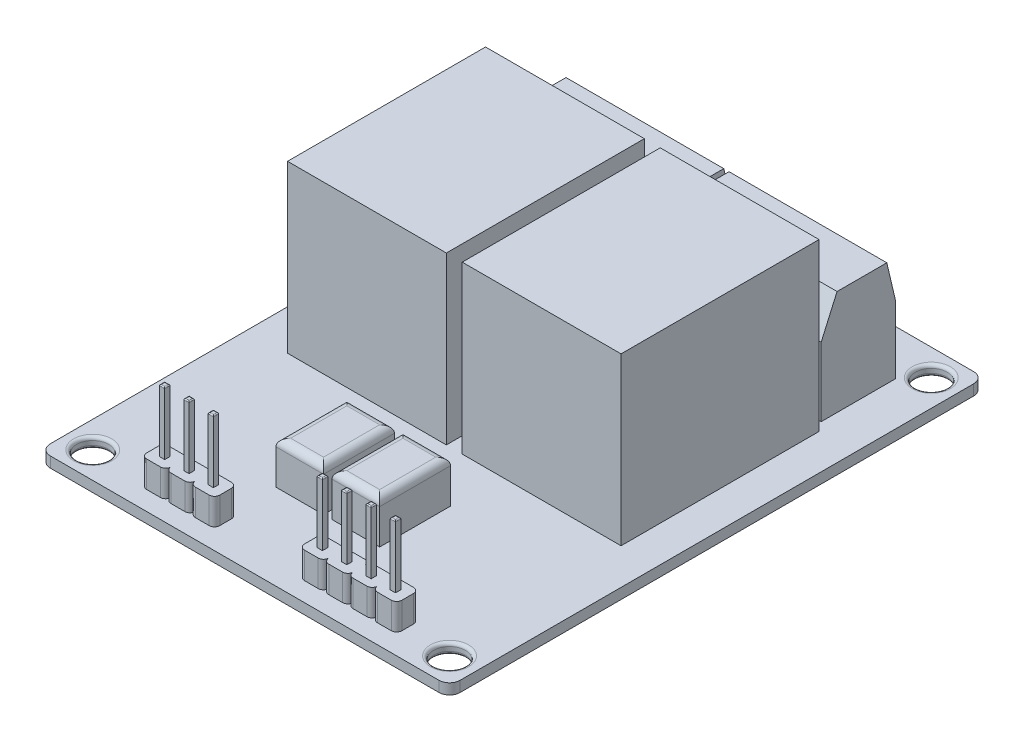
from build123d import *

# Parameters (mm, degrees)
CROQUIS1_W               = 38.7
CROQUIS1_H               = 50.5
SALIENTE_EXTRUIR1_DEPTH  = 1
CROQUIS2_W               = 15
CROQUIS2_H               = 18.7
SALIENTE_EXTRUIR2_DEPTH  = 15.7
CROQUIS3_W               = 14.9
CROQUIS3_H               = 7
SALIENTE_EXTRUIR3_DEPTH  = 9.9
CORTAR_EXTRUIR1_DEPTH    = 64.197310069
CROQUIS5_W               = 4.5
CROQUIS5_H               = 6.7
SALIENTE_EXTRUIR4_DEPTH  = 4
REDONDEO1_R              = 0.7
CROQUIS6_W               = 2.3
CROQUIS6_H               = 2.1
SALIENTE_EXTRUIR5_DEPTH  = 2.5
REDONDEO2_R              = 0.5
CROQUIS6_3_W             = 2.3
CROQUIS6_3_H             = 2.1
SALIENTE_EXTRUIR6_DEPTH  = 2.5
REDONDEO4_R              = 0.5
CROQUIS6_4_W             = 2.3
CROQUIS6_4_H             = 2.1
SALIENTE_EXTRUIR7_DEPTH  = 2.5
REDONDEO5_R              = 0.5
CROQUIS6_5_W             = 2.3
CROQUIS6_5_H             = 2.1
SALIENTE_EXTRUIR8_DEPTH  = 2.5
REDONDEO6_R              = 0.5
CROQUIS6_6_W             = 2.3
CROQUIS6_6_H             = 2.1
SALIENTE_EXTRUIR9_DEPTH  = 2.5
REDONDEO7_R              = 0.5
CROQUIS6_7_W             = 2.3
CROQUIS6_7_H             = 2.1
SALIENTE_EXTRUIR10_DEPTH = 2.5
REDONDEO8_R              = 0.5
CROQUIS8_W               = 0.5
CROQUIS8_H               = 0.5
SALIENTE_EXTRUIR11_DEPTH = 5.9
REDONDEO13_R             = 0.1
REDONDEO14_R             = 1
REDONDEO15_R             = 1
CROQUIS9_R               = 1.5
CORTAR_EXTRUIR2_DEPTH    = 5.9
REDONDEO16_R             = 0.3


# Some blends are built 0.0001 mm under size
with BuildPart() as part:
    # Croquis1 → Saliente-Extruir1 (new body)
    with BuildSketch(Plane(origin=(0, 0, 0), x_dir=(1, 0, 0), z_dir=(0, 1, 0))):
        with Locations((19.35, -25.25)):
            Rectangle(CROQUIS1_W, CROQUIS1_H)
    extrude(amount=-SALIENTE_EXTRUIR1_DEPTH)

    # Croquis2 → Saliente-Extruir2 (add)
    with BuildSketch(Plane(origin=(0, 0, 0), x_dir=(1, 0, 0), z_dir=(0, 1, 0))):
        with Locations((11.3, -21.55)):
            Rectangle(CROQUIS2_W, CROQUIS2_H)
        with Locations((27.8, -21.55)):
            Rectangle(CROQUIS2_W, CROQUIS2_H)
    extrude(amount=SALIENTE_EXTRUIR2_DEPTH)

    # Croquis3 → Saliente-Extruir3 (add)
    with BuildSketch(Plane(origin=(0, 0, 0), x_dir=(1, 0, 0), z_dir=(0, 1, 0))):
        with Locations((11.75, -7.8)):
            Rectangle(CROQUIS3_W, CROQUIS3_H)
        with Locations((27.15, -7.8)):
            Rectangle(CROQUIS3_W, CROQUIS3_H)
    extrude(amount=SALIENTE_EXTRUIR3_DEPTH)

    # Croquis4 → Cortar-Extruir1 (cut, through all)
    with BuildSketch(Plane(origin=(34.6, 0, 0), x_dir=(0, 0, -1), z_dir=(1, 0, 0))):
        Polygon((-11.3, 9.9), (-11.3, 6.5), (-9.8, 9.9), align=None)
        Polygon((-5.1, 9.9), (-4.3, 6.5), (-4.3, 9.9), align=None)
    extrude(amount=-CORTAR_EXTRUIR1_DEPTH, mode=Mode.SUBTRACT)

    # Croquis5 → Saliente-Extruir4 (add)
    with BuildSketch(Plane(origin=(0, 0, 0), x_dir=(1, 0, 0), z_dir=(0, 1, 0))):
        with Locations((16.45, -39.05)):
            Rectangle(CROQUIS5_W, CROQUIS5_H)
        with Locations((21.75, -39.05)):
            Rectangle(CROQUIS5_W, CROQUIS5_H)
    extrude(amount=SALIENTE_EXTRUIR4_DEPTH)

    # Redondeo1
    redondeo1_edges = [part.edges().sort_by_distance(p)[0] for p in [
        (14.2, 4, 39.05),
        (16.45, 4, 42.4),
        (18.7, 4, 39.05),
        (16.45, 4, 35.7),
        (19.5, 4, 39.05),
        (21.75, 4, 42.4),
        (24, 4, 39.05),
        (21.75, 4, 35.7),
    ]]
    fillet(redondeo1_edges, radius=REDONDEO1_R)

    # Croquis6 → Saliente-Extruir5 (add)
    with BuildSketch(Plane(origin=(0, 0, 0), x_dir=(1, 0, 0), z_dir=(0, 1, 0))):
        with Locations((30.75, -47.65)):
            Rectangle(CROQUIS6_W, CROQUIS6_H)
    extrude(amount=SALIENTE_EXTRUIR5_DEPTH)

    # Redondeo2
    redondeo2_edges = [part.edges().sort_by_distance(p)[0] for p in [
        (31.9, 1.25, 46.6),
        (29.6, 1.25, 46.6),
        (29.6, 1.25, 48.7),
        (31.9, 1.25, 48.7),
    ]]
    fillet(redondeo2_edges, radius=REDONDEO2_R)

    # Croquis6<3> → Saliente-Extruir6 (add)
    with BuildSketch(Plane(origin=(0, 0, 0), x_dir=(1, 0, 0), z_dir=(0, 1, 0))):
        with Locations((28.45, -47.65)):
            Rectangle(CROQUIS6_3_W, CROQUIS6_3_H)
    extrude(amount=SALIENTE_EXTRUIR6_DEPTH)

    # Redondeo4
    redondeo4_edges = [part.edges().sort_by_distance(p)[0] for p in [
        (27.3, 1.25, 48.7),
        (29.6, 1.25, 46.6),
        (27.3, 1.25, 46.6),
        (29.6, 1.25, 48.7),
    ]]
    fillet(redondeo4_edges, radius=REDONDEO4_R - 0.0001)  # a hair under: the kernel refuses the full size

    # Croquis6<4> → Saliente-Extruir7 (add)
    with BuildSketch(Plane(origin=(0, 0, 0), x_dir=(1, 0, 0), z_dir=(0, 1, 0))):
        with Locations((26.15, -47.65)):
            Rectangle(CROQUIS6_4_W, CROQUIS6_4_H)
    extrude(amount=SALIENTE_EXTRUIR7_DEPTH)

    # Redondeo5
    # the kernel refuses this fillet: 0.5 mm, written as the material it takes off along each edge
    with BuildSketch(Plane(origin=(27.3, 0, 46.6), x_dir=(-1, 0, 0), z_dir=(0, 1, 0))) as redondeo5_piece_1_section:
        with BuildLine():
            CenterArc((0.49999999, 0.5), REDONDEO5_R, 180.011459156, 89.988540844)
            Line((0, 0.4999), (-0.01, 0.499898))
            Line((-0.01, 0.499898), (-0.01, 0))
            Line((-0.01, 0), (0, -0.01))
            Line((0, -0.01), (0.49999999, -0.01))
            Line((0.49999999, -0.01), (0.49999999, 0))
        make_face()
    redondeo5_piece_1 = extrude(amount=3.749999975, mode=Mode.PRIVATE)
    redondeo5_piece_1 = redondeo5_piece_1 - Plane(origin=(27.7999, 1.874999988, 47.0999), x_dir=(-1, 0, 0), z_dir=(0, 1, 0)) * Cylinder(0.4999, 10, mode=Mode.PRIVATE)
    add(redondeo5_piece_1, mode=Mode.SUBTRACT)
    with BuildSketch(Plane(origin=(25, 0, 46.6), x_dir=(0, 0, 1), z_dir=(0, 1, 0)), Plane(origin=(25, 0, 48.7), x_dir=(1, 0, 0), z_dir=(0, 1, 0))) as redondeo5_piece_2:
        with BuildLine():
            CenterArc((REDONDEO5_R, REDONDEO5_R), REDONDEO5_R, 180, 90)
            Line((0, REDONDEO5_R), (-REDONDEO5_R * 0.02, REDONDEO5_R))
            Line((-REDONDEO5_R * 0.02, REDONDEO5_R), (-REDONDEO5_R * 0.02, -REDONDEO5_R * 0.02))
            Line((-REDONDEO5_R * 0.02, -REDONDEO5_R * 0.02), (REDONDEO5_R, -REDONDEO5_R * 0.02))
            Line((REDONDEO5_R, -REDONDEO5_R * 0.02), (REDONDEO5_R, 0))
        make_face()
    extrude(amount=3.75, mode=Mode.SUBTRACT)
    with BuildSketch(Plane(origin=(27.3, 0, 48.7), x_dir=(0, 0, -1), z_dir=(0, 1, 0))) as redondeo5_piece_3_section:
        with BuildLine():
            CenterArc((0.5, 0.49999999), REDONDEO5_R, 180, 89.988540844)
            Line((0, 0.49999999), (-0.01, 0.49999999))
            Line((-0.01, 0.49999999), (-0.01, 0))
            Line((-0.01, 0), (0, -0.01))
            Line((0, -0.01), (0.499898, -0.01))
            Line((0.499898, -0.01), (0.4999, 0))
        make_face()
    redondeo5_piece_3 = extrude(amount=3.749999975, mode=Mode.PRIVATE)
    redondeo5_piece_3 = redondeo5_piece_3 - Plane(origin=(27.7999, 1.874999988, 48.2001), x_dir=(0, 0, 1), z_dir=(0, 1, 0)) * Cylinder(0.4999, 10, mode=Mode.PRIVATE)
    add(redondeo5_piece_3, mode=Mode.SUBTRACT)

    # Croquis6<5> → Saliente-Extruir8 (add)
    with BuildSketch(Plane(origin=(0, 0, 0), x_dir=(1, 0, 0), z_dir=(0, 1, 0))):
        with Locations((23.85, -47.65)):
            Rectangle(CROQUIS6_5_W, CROQUIS6_5_H)
    extrude(amount=SALIENTE_EXTRUIR8_DEPTH)

    # Redondeo6
    redondeo6_edges = [part.edges().sort_by_distance(p)[0] for p in [
        (25, 1.25, 46.6),
        (22.7, 1.25, 46.6),
        (22.7, 1.25, 48.7),
        (25, 1.25, 48.7),
    ]]
    fillet(redondeo6_edges, radius=REDONDEO6_R - 0.0001)  # a hair under: the kernel refuses the full size

    # Croquis6<6> → Saliente-Extruir9 (add)
    with BuildSketch(Plane(origin=(0, 0, 0), x_dir=(1, 0, 0), z_dir=(0, 1, 0))):
        with Locations((13.55, -47.65)):
            Rectangle(CROQUIS6_6_W, CROQUIS6_6_H)
        with Locations((8.95, -47.65)):
            Rectangle(CROQUIS6_6_W, CROQUIS6_6_H)
    extrude(amount=SALIENTE_EXTRUIR9_DEPTH)

    # Redondeo7
    redondeo7_edges = [part.edges().sort_by_distance(p)[0] for p in [
        (14.7, 1.25, 46.6),
        (12.4, 1.25, 46.6),
        (12.4, 1.25, 48.7),
        (14.7, 1.25, 48.7),
        (10.1, 1.25, 46.6),
        (7.8, 1.25, 46.6),
        (7.8, 1.25, 48.7),
        (10.1, 1.25, 48.7),
    ]]
    fillet(redondeo7_edges, radius=REDONDEO7_R)

    # Croquis6<7> → Saliente-Extruir10 (add)
    with BuildSketch(Plane(origin=(0, 0, 0), x_dir=(1, 0, 0), z_dir=(0, 1, 0))):
        with Locations((11.25, -47.65)):
            Rectangle(CROQUIS6_7_W, CROQUIS6_7_H)
    extrude(amount=SALIENTE_EXTRUIR10_DEPTH)

    # Redondeo8
    redondeo8_edges = [part.edges().sort_by_distance(p)[0] for p in [
        (10.1, 1.25, 46.6),
        (10.1, 1.25, 48.7),
        (12.4, 1.25, 48.7),
        (12.4, 1.25, 46.6),
    ]]
    fillet(redondeo8_edges, radius=REDONDEO8_R - 0.0001)  # a hair under: the kernel refuses the full size

    # Croquis8 → Saliente-Extruir11 (add)
    with BuildSketch(Plane(origin=(0, 2.5, 0), x_dir=(1, 0, 0), z_dir=(0, 1, 0))):
        with Locations((11.25, -47.65)):
            Rectangle(CROQUIS8_W, CROQUIS8_H)
        with Locations((8.95, -47.65)):
            Rectangle(CROQUIS8_W, CROQUIS8_H)
        with Locations((13.55, -47.65)):
            Rectangle(CROQUIS8_W, CROQUIS8_H)
        with Locations((23.85, -47.65)):
            Rectangle(CROQUIS8_W, CROQUIS8_H)
        with Locations((26.15, -47.65)):
            Rectangle(CROQUIS8_W, CROQUIS8_H)
        with Locations((28.45, -47.65)):
            Rectangle(CROQUIS8_W, CROQUIS8_H)
        with Locations((30.75, -47.65)):
            Rectangle(CROQUIS8_W, CROQUIS8_H)
    extrude(amount=SALIENTE_EXTRUIR11_DEPTH)

    # Redondeo13
    redondeo13_edges = [part.edges().sort_by_distance(p)[0] for p in [
        (8.7, 8.4, 47.65),
        (8.95, 8.4, 47.9),
        (9.2, 8.4, 47.65),
        (8.95, 8.4, 47.4),
        (11, 8.4, 47.65),
        (11.25, 8.4, 47.9),
        (11.5, 8.4, 47.65),
        (11.25, 8.4, 47.4),
        (13.3, 8.4, 47.65),
        (13.55, 8.4, 47.9),
        (13.8, 8.4, 47.65),
        (13.55, 8.4, 47.4),
        (23.6, 8.4, 47.65),
        (23.85, 8.4, 47.9),
        (24.1, 8.4, 47.65),
        (23.85, 8.4, 47.4),
        (25.9, 8.4, 47.65),
        (26.15, 8.4, 47.9),
        (26.4, 8.4, 47.65),
        (26.15, 8.4, 47.4),
        (28.2, 8.4, 47.65),
        (28.45, 8.4, 47.9),
        (28.7, 8.4, 47.65),
        (28.45, 8.4, 47.4),
        (30.5, 8.4, 47.65),
        (30.75, 8.4, 47.9),
        (31, 8.4, 47.65),
        (30.75, 8.4, 47.4),
    ]]
    fillet(redondeo13_edges, radius=REDONDEO13_R)

    # Redondeo14
    redondeo14_edges = [part.edges().sort_by_distance(p)[0] for p in [
        (38.7, -0.5, 50.5),
        (0, -0.5, 50.5),
    ]]
    fillet(redondeo14_edges, radius=REDONDEO14_R)

    # Redondeo15
    redondeo15_edges = [part.edges().sort_by_distance(p)[0] for p in [
        (0, -0.5, 0),
        (38.7, -0.5, 0),
    ]]
    fillet(redondeo15_edges, radius=REDONDEO15_R)

    # Croquis9 → Cortar-Extruir2 (cut)
    with BuildSketch(Plane(origin=(0, 0, 0), x_dir=(1, 0, 0), z_dir=(0, 1, 0))):
        with Locations(Location((2.5, -2.5, 0), (0, 0, 270))):
            Circle(CROQUIS9_R)
        with Locations(Location((36.2, -2.5, 0), (0, 0, 270))):
            Circle(CROQUIS9_R)
        with Locations(Location((36.2, -48, 0), (0, 0, 270))):
            Circle(CROQUIS9_R)
        with Locations(Location((2.5, -48, 0), (0, 0, 270))):
            Circle(CROQUIS9_R)
    extrude(amount=-CORTAR_EXTRUIR2_DEPTH, mode=Mode.SUBTRACT)

    # Redondeo16
    redondeo16_edges = [part.edges().sort_by_distance(p)[0] for p in [
        (2.5, -1, 1),
        (2.5, 0, 1),
        (36.2, -1, 1),
        (36.2, 0, 1),
        (36.2, -1, 46.5),
        (36.2, 0, 46.5),
        (2.5, -1, 46.5),
        (2.5, 0, 46.5),
    ]]
    fillet(redondeo16_edges, radius=REDONDEO16_R)


solid = part.part
